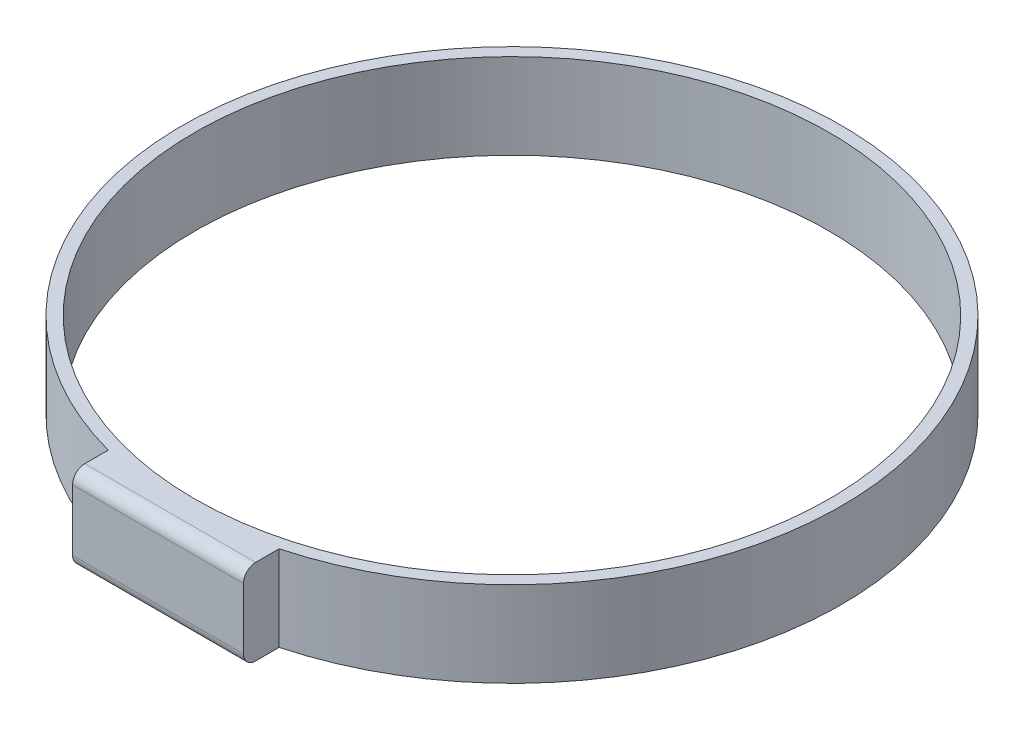
from build123d import *

# Parameters (mm, degrees)
SKETCH1_R           = 27
SKETCH1_R_2         = 26
BOSS_EXTRUDE1_DEPTH = 7
SKETCH2_W           = 14
SKETCH2_H           = 7
BOSS_EXTRUDE2_DEPTH = 3
FILLET1_R           = 1


with BuildPart() as part:
    # Sketch1 → Boss-Extrude1 (new body)
    with BuildSketch(Plane(origin=(0, 0, 0), x_dir=(1, 0, 0), z_dir=(0, 1, 0))):
        Circle(SKETCH1_R)
        Circle(SKETCH1_R_2, mode=Mode.SUBTRACT)
    extrude(amount=BOSS_EXTRUDE1_DEPTH)

    # Sketch2 → Boss-Extrude2 (add)
    with BuildSketch(Plane.XY.offset(26)):
        with Locations((0, 3.5)):
            Rectangle(SKETCH2_W, SKETCH2_H)
    extrude(amount=BOSS_EXTRUDE2_DEPTH)

    # Fillet1
    fillet1_edges = [part.edges().sort_by_distance(p)[0] for p in [
        (0, 0, 29),
        (0, 7, 29),
    ]]
    fillet(fillet1_edges, radius=FILLET1_R)


solid = part.part
